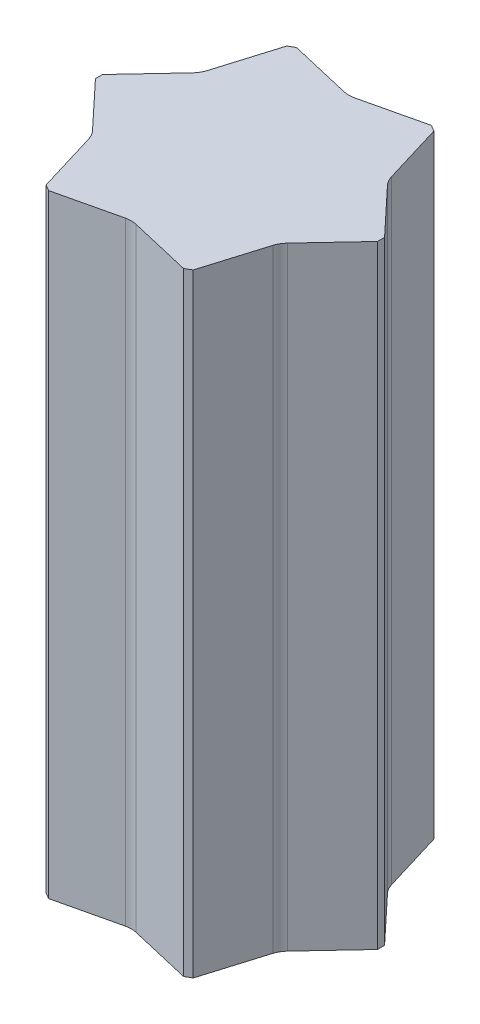
from build123d import *

# Parameters (mm, degrees)
EXTRUDE_1_DEPTH     = 1500
CUT_EXTRUDE_4_DEPTH = 1500
SHELL_START         = 10
SHELL_3_DEPTH       = 1480


# Read off the part's stored shape, not the designer's step: 抽壳3
with BuildPart() as part:
    # 草图2 → 凸台-拉伸1 (new body)
    with BuildSketch(Plane(origin=(0, 0, 0), x_dir=(1, 0, 0), z_dir=(0, 1, 0))):
        Polygon((345, 8.660254038), (180, 294.448637287), (165, 303.108891325), (-165, 303.108891325), (-180, 294.448637287), (-345, 8.660254038), (-345, -8.660254038), (-180, -294.448637287), (-165, -303.108891325), (165, -303.108891325), (180, -294.448637287), (345, -8.660254038), align=None)
    extrude(amount=EXTRUDE_1_DEPTH)

    # 草图5 → 切除-拉伸4 (cut)
    with BuildSketch(Plane(origin=(0, 0, 0), x_dir=(1, 0, 0), z_dir=(0, 1, 0))):
        with BuildLine():
            Line((238.21737139, 122.528375301), (345, 8.660254038))
            Line((345, 8.660254038), (379.520233023, 28.590519866))
            Line((379.520233023, 28.590519866), (334.34391274, 178.027059826))
            ThreePointArc((334.34391274, 178.027059826), (329.146090081, 190.032583711), (321.34791274, 200.536792121))
            Line((321.34791274, 200.536792121), (214.969297582, 314.638170659))
            Line((214.969297582, 314.638170659), (180, 294.448637287))
            Line((180, 294.448637287), (225.22137139, 145.038107596))
            ThreePointArc((225.22137139, 145.038107596), (230.419194049, 133.032583711), (238.21737139, 122.528375301))
        make_face()
        with BuildLine():
            Line((225.22137139, -145.038107596), (180, -294.448637287))
            Line((180, -294.448637287), (214.520233023, -314.378903115))
            Line((214.520233023, -314.378903115), (321.34791274, -200.536792121))
            ThreePointArc((321.34791274, -200.536792121), (329.146090081, -190.032583711), (334.34391274, -178.027059826))
            Line((334.34391274, -178.027059826), (379.969297582, -28.84978741))
            Line((379.969297582, -28.84978741), (345, -8.660254038))
            Line((345, -8.660254038), (238.21737139, -122.528375301))
            ThreePointArc((238.21737139, -122.528375301), (230.419194049, -133.032583711), (225.22137139, -145.038107596))
        make_face()
        with BuildLine():
            Line((12.996, 267.566482896), (165, 303.108891325))
            Line((165, 303.108891325), (165, 342.969422981))
            Line((165, 342.969422981), (12.996, 378.563851946))
            ThreePointArc((12.996, 378.563851946), (0, 380.065167421), (-12.996, 378.563851946))
            Line((-12.996, 378.563851946), (-165, 343.487958069))
            Line((-165, 343.487958069), (-165, 303.108891325))
            Line((-165, 303.108891325), (-12.996, 267.566482896))
            ThreePointArc((-12.996, 267.566482896), (0, 266.065167421), (12.996, 267.566482896))
        make_face()
        with BuildLine():
            Line((-12.996, -267.566482896), (-165, -303.108891325))
            Line((-165, -303.108891325), (-165, -342.969422981))
            Line((-165, -342.969422981), (-12.996, -378.563851946))
            ThreePointArc((-12.996, -378.563851946), (0, -380.065167421), (12.996, -378.563851946))
            Line((12.996, -378.563851946), (165, -343.487958069))
            Line((165, -343.487958069), (165, -303.108891325))
            Line((165, -303.108891325), (12.996, -267.566482896))
            ThreePointArc((12.996, -267.566482896), (0, -266.065167421), (-12.996, -267.566482896))
        make_face()
        with BuildLine():
            Line((-238.21737139, -122.528375301), (-345, -8.660254038))
            Line((-345, -8.660254038), (-379.520233023, -28.590519866))
            Line((-379.520233023, -28.590519866), (-334.34391274, -178.027059826))
            ThreePointArc((-334.34391274, -178.027059826), (-329.146090081, -190.032583711), (-321.34791274, -200.536792121))
            Line((-321.34791274, -200.536792121), (-214.969297582, -314.638170659))
            Line((-214.969297582, -314.638170659), (-180, -294.448637287))
            Line((-180, -294.448637287), (-225.22137139, -145.038107596))
            ThreePointArc((-225.22137139, -145.038107596), (-230.419194049, -133.032583711), (-238.21737139, -122.528375301))
        make_face()
        with BuildLine():
            Line((-225.22137139, 145.038107596), (-180, 294.448637287))
            Line((-180, 294.448637287), (-214.520233023, 314.378903115))
            Line((-214.520233023, 314.378903115), (-321.34791274, 200.536792121))
            ThreePointArc((-321.34791274, 200.536792121), (-329.14609008, 190.032583711), (-334.34391274, 178.027059826))
            Line((-334.34391274, 178.027059826), (-379.969297582, 28.84978741))
            Line((-379.969297582, 28.84978741), (-345, 8.660254038))
            Line((-345, 8.660254038), (-238.21737139, 122.528375301))
            ThreePointArc((-238.21737139, 122.528375301), (-230.419194049, 133.032583711), (-225.22137139, 145.038107596))
        make_face()
    extrude(amount=CUT_EXTRUDE_4_DEPTH, mode=Mode.SUBTRACT)

    # 抽壳3 outline → 抽壳3 (cut)
    with BuildSketch(Plane(origin=(0, 0, 0), x_dir=(1, 0, 0), z_dir=(0, 1, 0)).offset(SHELL_START)):
        with BuildLine():
            Line((-163.425407286, 292.470977468), (-171.574592714, 287.766043068))
            Line((-171.574592714, 287.766043068), (-215.64921864, 142.144339856))
            ThreePointArc((-215.64921864, 142.144339856), (-221.758128865, 128.033988697), (-230.922998431, 115.687897825))
            Line((-230.922998431, 115.687897825), (-335, 4.7049344))
            Line((-335, 4.7049344), (-335, -4.7049344))
            Line((-335, -4.7049344), (-230.92521864, -115.68553172))
            ThreePointArc((-230.92521864, -115.68553172), (-221.759751192, -128.031178744), (-215.650157642, -142.141234046))
            Line((-215.650157642, -142.141234046), (-171.574592714, -287.766043068))
            Line((-171.574592714, -287.766043068), (-163.425407286, -292.470977468))
            Line((-163.425407286, -292.470977468), (-15.276, -257.829871576))
            ThreePointArc((-15.276, -257.829871576), (-0.001622327, -256.065167441), (15.272840788, -257.829131872))
            Line((15.272840788, -257.829131872), (163.425407286, -292.470977468))
            Line((163.425407286, -292.470977468), (171.574592714, -287.766043068))
            Line((171.574592714, -287.766043068), (215.64921864, -142.144339856))
            ThreePointArc((215.64921864, -142.144339856), (221.758128865, -128.033988697), (230.922998431, -115.687897825))
            Line((230.922998431, -115.687897825), (335, -4.704934401))
            Line((335, -4.704934401), (335, 4.7049344))
            Line((335, 4.7049344), (230.92521864, 115.68553172))
            ThreePointArc((230.92521864, 115.68553172), (221.759751192, 128.031178744), (215.650157642, 142.141234046))
            Line((215.650157642, 142.141234046), (171.574592714, 287.766043068))
            Line((171.574592714, 287.766043068), (163.425407286, 292.470977468))
            Line((163.425407286, 292.470977468), (15.276, 257.829871576))
            ThreePointArc((15.276, 257.829871576), (0.001622327, 256.065167441), (-15.272840788, 257.829131872))
            Line((-15.272840788, 257.829131872), (-163.425407286, 292.470977468))
        make_face()
    extrude(amount=SHELL_3_DEPTH, mode=Mode.SUBTRACT)


solid = part.part
